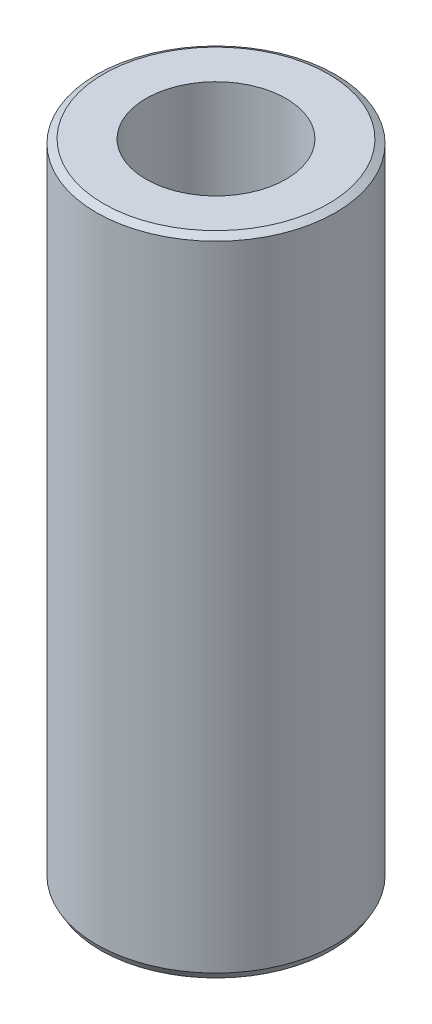
from build123d import *
from OCP.BRepFilletAPI import BRepFilletAPI_MakeChamfer

# Parameters (mm, degrees)
SKETCH1_R           = 20
BOSS_EXTRUDE1_DEPTH = 107.913975447
SKETCH2_R           = 11.710733936
CUT_EXTRUDE1_DEPTH  = 112.559069989
CHAMFER1_SIZE       = 0.689281382
CHAMFER1_SIZE2      = 1.193870374


with BuildPart() as part:
    # Sketch1 → Boss-Extrude1 (new body)
    with BuildSketch(Plane(origin=(0, 0, 0), x_dir=(1, 0, 0), z_dir=(0, 1, 0))):
        Circle(SKETCH1_R)
    extrude(amount=BOSS_EXTRUDE1_DEPTH)

    # Sketch2 → Cut-Extrude1 (cut, through all)
    with BuildSketch(Plane(origin=(0, 0, 0), x_dir=(1, 0, 0), z_dir=(0, 1, 0))):
        Circle(SKETCH2_R)
    extrude(amount=CUT_EXTRUDE1_DEPTH, mode=Mode.SUBTRACT)

    # Chamfer1: one chamfer whose edges measure the first distance from different faces: ONE call of the kernel's chamfer builder (chamfer() names one face for all edges)
    chamfer1_edges_1 = [part.edges().sort_by_distance(p)[0] for p in [
        (-20, 107.913975447, 0),
    ]]
    chamfer1_side_1 = [part.faces().sort_by_distance(p)[0] for p in [
        (-20, 53.956987723, 0),
    ]]
    chamfer1_edges_2 = [part.edges().sort_by_distance(p)[0] for p in [
        (-20, 0, 0),
    ]]
    chamfer1_side_2 = [part.faces().sort_by_distance(p)[0] for p in [
        (-19.434314575, 0, 0),
    ]]
    chamfer1 = BRepFilletAPI_MakeChamfer(part.part.solid().wrapped)
    for e in chamfer1_edges_1:
        chamfer1.Add(CHAMFER1_SIZE, CHAMFER1_SIZE2, e.wrapped, chamfer1_side_1[0].wrapped)  # the first distance lies on this face
    for e in chamfer1_edges_2:
        chamfer1.Add(CHAMFER1_SIZE, CHAMFER1_SIZE2, e.wrapped, chamfer1_side_2[0].wrapped)  # the first distance lies on this face
    add(Compound.cast(chamfer1.Shape()), mode=Mode.REPLACE)


solid = part.part
